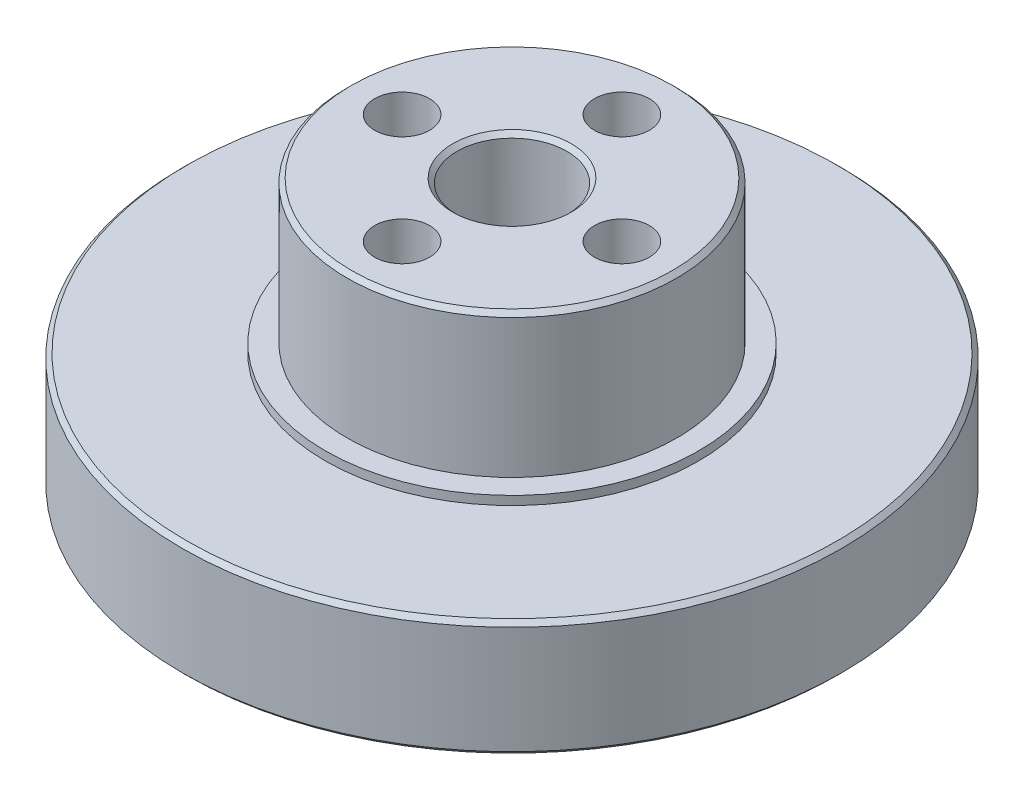
from build123d import *

# Parameters (mm, degrees)
SKETCH_1_R          = 15
SKETCH_1_R_2        = 1.83
EXTRUDE_1_DEPTH     = 3.7
SKETCH_2_R          = 15
EXTRUDE_2_DEPTH     = 1.6
SKETCH_3_R          = 8.5
EXTRUDE_3_DEPTH     = 0.4
SKETCH_4_R          = 7.5
EXTRUDE_4_DEPTH     = 6.5
SKETCH_5_R          = 1.25
SKETCH_5_R_2        = 2.5
CUT_EXTRUDE_1_DEPTH = 7
CHAMFER_1_SIZE      = 0.2
SKETCH_7_R          = 2.5
CUT_EXTRUDE_4_DEPTH = 23.338307904
SKETCH_8_R          = 6
CUT_EXTRUDE_5_DEPTH = 2
CHAMFER_2_SIZE      = 0.5


with BuildPart() as part:
    # 草图1 → 凸台-拉伸1 (new body)
    with BuildSketch(Plane(origin=(0, 0, 0), x_dir=(1, 0, 0), z_dir=(0, 1, 0))):
        Circle(SKETCH_1_R)
        with Locations((0, 11.525)):
            Circle(SKETCH_1_R_2, mode=Mode.SUBTRACT)
        with Locations((9.980942779, 5.7625)):
            Circle(SKETCH_1_R_2, mode=Mode.SUBTRACT)
        with Locations((9.980942779, -5.7625)):
            Circle(SKETCH_1_R_2, mode=Mode.SUBTRACT)
        with Locations((0, -11.525)):
            Circle(SKETCH_1_R_2, mode=Mode.SUBTRACT)
        with Locations((-9.980942779, -5.7625)):
            Circle(SKETCH_1_R_2, mode=Mode.SUBTRACT)
        with Locations((-9.980942779, 5.7625)):
            Circle(SKETCH_1_R_2, mode=Mode.SUBTRACT)
    extrude(amount=EXTRUDE_1_DEPTH)

    # 草图2 → 凸台-拉伸2 (add)
    with BuildSketch(Plane(origin=(0, 3.7, 0), x_dir=(1, 0, 0), z_dir=(0, 1, 0))):
        Circle(SKETCH_2_R)
    extrude(amount=EXTRUDE_2_DEPTH)

    # 草图3 → 凸台-拉伸3 (add)
    with BuildSketch(Plane(origin=(0, 5.3, 0), x_dir=(1, 0, 0), z_dir=(0, 1, 0))):
        Circle(SKETCH_3_R)
    extrude(amount=EXTRUDE_3_DEPTH)

    # 草图4 → 凸台-拉伸4 (add)
    with BuildSketch(Plane(origin=(0, 5.7, 0), x_dir=(1, 0, 0), z_dir=(0, 1, 0))):
        Circle(SKETCH_4_R)
    extrude(amount=EXTRUDE_4_DEPTH)

    # 草图5 → 切除-拉伸1 (cut)
    with BuildSketch(Plane(origin=(0, 12.2, 0), x_dir=(1, 0, 0), z_dir=(0, 1, 0))):
        with Locations((0, 5)):
            Circle(SKETCH_5_R)
        with Locations((5, 0)):
            Circle(SKETCH_5_R)
        with Locations((0, -5)):
            Circle(SKETCH_5_R)
        with Locations((-5, 0)):
            Circle(SKETCH_5_R)
        Circle(SKETCH_5_R_2)
    extrude(amount=-CUT_EXTRUDE_1_DEPTH, mode=Mode.SUBTRACT)

    # 倒角1
    chamfer_1_edges = [part.edges().sort_by_distance(p)[0] for p in [
        (-11.810942779, 0, -5.7625),
        (-11.810942779, 0, 5.7625),
        (-1.83, 0, 11.525),
        (8.150942779, 0, 5.7625),
        (8.150942779, 0, -5.7625),
        (-1.83, 0, -11.525),
        (-15, 0, 0),
        (-7.5, 12.2, 0),
        (-15, 5.3, 0),
        (-2.5, 12.2, 0),
    ]]
    chamfer(chamfer_1_edges, length=CHAMFER_1_SIZE)

    # 草图7 → 切除-拉伸4 (cut, through all)
    with BuildSketch(Plane(origin=(0, 5.2, 0), x_dir=(1, 0, 0), z_dir=(0, 1, 0))):
        Circle(SKETCH_7_R)
    extrude(amount=-CUT_EXTRUDE_4_DEPTH, mode=Mode.SUBTRACT)

    # 草图8 → 切除-拉伸5 (cut)
    with BuildSketch(Plane(origin=(0, 0, 0), x_dir=(-1, 0, 0), z_dir=(0, -1, 0))):
        Circle(SKETCH_8_R)
    extrude(amount=-CUT_EXTRUDE_5_DEPTH, mode=Mode.SUBTRACT)

    # 倒角2
    chamfer_2_edges = [part.edges().sort_by_distance(p)[0] for p in [
        (6, 0, 0),
        (-2.5, 2, 0),
        (6, 2, 0),
    ]]
    chamfer(chamfer_2_edges, length=CHAMFER_2_SIZE)


solid = part.part
